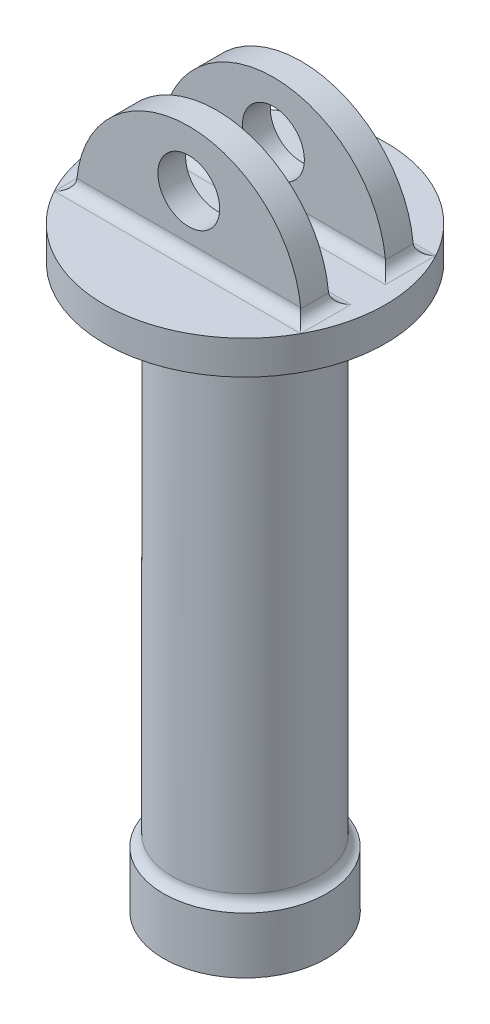
from build123d import *

# Parameters (mm, degrees)
SKETCH2_R            = 13
SKETCH2_R_2          = 10
BOSS_EXTRUDE3_DEPTH  = 100
SKETCH2_3_R          = 14.5
SKETCH2_3_R_2        = 13
BOSS_EXTRUDE5_DEPTH  = 10
SKETCH8_R            = 25
BOSS_EXTRUDE7_DEPTH  = 6
SKETCH11_R           = 5.5
BOSS_EXTRUDE12_DEPTH = 10
SKETCH14_W           = 47.941155358
SKETCH14_H           = 10.12177459
CUT_EXTRUDE2_DEPTH   = 112.740771431
FILLET1_START        = -12.0000001
FILLET1_2_DEPTH      = 2.0000001
FILLET1_START_2      = 3.060887195
FILLET1_3_DEPTH      = 2.0000001
FILLET1_START_3      = -5.060887295
FILLET1_4_DEPTH      = 2
FILLET1_START_4      = 10
FILLET1_5_DEPTH      = 2
FILLET1_START_5      = -10
FILLET1_6_DEPTH      = 4.939112705
FILLET1_START_6      = 5.060887295
FILLET1_7_DEPTH      = 4.939112705
FILLET1_START_7      = -21.9089024
FILLET1_8_DEPTH      = 43.8178047


with BuildPart() as part:
    # Sketch2 → Boss-Extrude3 (new body)
    with BuildSketch(Plane(origin=(0, 0, 0), x_dir=(1, 0, 0), z_dir=(0, 1, 0))):
        with Locations(Location((0, 0, 0), (0, 0, 270))):
            Circle(SKETCH2_R)
        with Locations(Location((0, 0, 0), (0, 0, 270))):
            Circle(SKETCH2_R_2, mode=Mode.SUBTRACT)
    extrude(amount=BOSS_EXTRUDE3_DEPTH)

    # Sketch2<3> → Boss-Extrude5 (add)
    with BuildSketch(Plane(origin=(0, 0, 0), x_dir=(1, 0, 0), z_dir=(0, 1, 0))):
        with Locations(Location((0, 0, 0), (0, 0, 270))):
            Circle(SKETCH2_3_R)
        with Locations(Location((0, 0, 0), (0, 0, 270))):
            Circle(SKETCH2_3_R_2, mode=Mode.SUBTRACT)
    extrude(amount=BOSS_EXTRUDE5_DEPTH)

    # Sketch8 → Boss-Extrude7 (add)
    with BuildSketch(Plane(origin=(0, 100, 0), x_dir=(1, 0, 0), z_dir=(0, 1, 0))):
        with Locations(Location((0, 0, 0), (0, 0, 270))):
            Circle(SKETCH8_R)
    extrude(amount=BOSS_EXTRUDE7_DEPTH)

    # Sketch11 → Boss-Extrude12 (add, symmetric)
    with BuildSketch(Plane.XY):
        with BuildLine():
            Line((20, 106), (-20, 106))
            ThreePointArc((-20, 106), (0, 126), (20, 106))
        make_face()
        with Locations((0, 116)):
            Circle(SKETCH11_R, mode=Mode.SUBTRACT)
    extrude(amount=BOSS_EXTRUDE12_DEPTH, both=True)

    # Sketch14 → Cut-Extrude2 (cut, through all)
    with BuildSketch(Plane(origin=(0, 106, 0), x_dir=(1, 0, 0), z_dir=(0, 1, 0))):
        Rectangle(SKETCH14_W, SKETCH14_H)
    extrude(amount=CUT_EXTRUDE2_DEPTH, mode=Mode.SUBTRACT)

    # Fillet1: read off the stored shape, not the designer's step
    # Fillet1 outline → Fillet1 (revolve)
    with BuildSketch(Plane.XY):
        with BuildLine():
            Line((15, 100), (13, 100))
            Line((13, 100), (13, 98))
            ThreePointArc((13, 98), (13.585786438, 99.414213562), (15, 100))
        make_face()
        with BuildLine():
            ThreePointArc((14.5, 10), (13.41886117, 10.711746802), (13, 11.936491673))
            Line((13, 11.936491673), (13, 10))
            Line((13, 10), (14.5, 10))
        make_face()
    revolve(axis=Axis((0, 0, 0), (0, 1, 0)))

    # Fillet1 2 outline → Fillet1 2 (add)
    with BuildSketch(Plane.XY.offset(FILLET1_START)):
        with BuildLine():
            ThreePointArc((21.9089023, 106), (20.560502575, 106.522902108), (19.917183909, 107.818181818))
            ThreePointArc((19.917183909, 107.818181818), (0, 126), (-19.917183909, 107.818181818))
            ThreePointArc((-19.917183909, 107.818181818), (-20.560502575, 106.522902108), (-21.9089023, 106))
            Line((-21.9089023, 106), (21.9089023, 106))
        make_face()
    extrude(amount=FILLET1_2_DEPTH)

    # Fillet1 3 outline → Fillet1 3 (add)
    with BuildSketch(Plane.XY.offset(FILLET1_START_2)):
        with BuildLine():
            ThreePointArc((21.9089023, 106), (20.560502575, 106.522902108), (19.917183909, 107.818181818))
            ThreePointArc((19.917183909, 107.818181818), (0, 126), (-19.917183909, 107.818181818))
            ThreePointArc((-19.917183909, 107.818181818), (-20.560502575, 106.522902108), (-21.9089023, 106))
            Line((-21.9089023, 106), (21.9089023, 106))
        make_face()
    extrude(amount=FILLET1_3_DEPTH)

    # Fillet1 4 outline → Fillet1 4 (add)
    with BuildSketch(Plane.XY.offset(FILLET1_START_3)):
        with BuildLine():
            ThreePointArc((21.9089023, 106), (20.560502575, 106.522902108), (19.917183909, 107.818181818))
            ThreePointArc((19.917183909, 107.818181818), (0, 126), (-19.917183909, 107.818181818))
            ThreePointArc((-19.917183909, 107.818181818), (-20.560502575, 106.522902108), (-21.9089023, 106))
            Line((-21.9089023, 106), (21.9089023, 106))
        make_face()
    extrude(amount=FILLET1_4_DEPTH)

    # Fillet1 5 outline → Fillet1 5 (add)
    with BuildSketch(Plane.XY.offset(FILLET1_START_4)):
        with BuildLine():
            ThreePointArc((21.9089023, 106), (20.560502575, 106.522902108), (19.917183909, 107.818181818))
            ThreePointArc((19.917183909, 107.818181818), (0, 126), (-19.917183909, 107.818181818))
            ThreePointArc((-19.917183909, 107.818181818), (-20.560502575, 106.522902108), (-21.9089023, 106))
            Line((-21.9089023, 106), (21.9089023, 106))
        make_face()
    extrude(amount=FILLET1_5_DEPTH)

    # Fillet1 6 outline → Fillet1 6 (add)
    with BuildSketch(Plane.XY.offset(FILLET1_START_5)):
        with BuildLine():
            Line((20, 106), (21.9089023, 106))
            ThreePointArc((21.9089023, 106), (20.560502575, 106.522902108), (19.917183909, 107.818181818))
            ThreePointArc((19.917183909, 107.818181818), (19.97928525, 106.910033465), (20, 106))
        make_face()
        with BuildLine():
            ThreePointArc((-20, 106), (-19.97928525, 106.910033465), (-19.917183909, 107.818181818))
            ThreePointArc((-19.917183909, 107.818181818), (-20.560502575, 106.522902108), (-21.9089023, 106))
            Line((-21.9089023, 106), (-20, 106))
        make_face()
    extrude(amount=FILLET1_6_DEPTH)

    # Fillet1 7 outline → Fillet1 7 (add)
    with BuildSketch(Plane.XY.offset(FILLET1_START_6)):
        with BuildLine():
            Line((20, 106), (21.9089023, 106))
            ThreePointArc((21.9089023, 106), (20.560502575, 106.522902108), (19.917183909, 107.818181818))
            ThreePointArc((19.917183909, 107.818181818), (19.97928525, 106.910033465), (20, 106))
        make_face()
        with BuildLine():
            ThreePointArc((-20, 106), (-19.97928525, 106.910033465), (-19.917183909, 107.818181818))
            ThreePointArc((-19.917183909, 107.818181818), (-20.560502575, 106.522902108), (-21.9089023, 106))
            Line((-21.9089023, 106), (-20, 106))
        make_face()
    extrude(amount=FILLET1_7_DEPTH)

    # Fillet1 8 outline → Fillet1 8 (cut)
    with BuildSketch(Plane.YZ.offset(FILLET1_START_7)):
        with BuildLine():
            Line((108, 10), (127, 10))
            Line((127, 10), (127, 12))
            Line((127, 12), (106, 12))
            ThreePointArc((106, 12), (106.585786438, 10.585786438), (108, 10))
        make_face()
        with BuildLine():
            Line((127, 3.060887195), (127, 5.060887295))
            Line((127, 5.060887295), (108, 5.060887295))
            ThreePointArc((108, 5.060887295), (106.585786438, 4.475100858), (106, 3.060887295))
            Line((106, 3.060887295), (127, 3.060887195))
        make_face()
        with BuildLine():
            Line((127, -5.060887295), (127, -3.060887295))
            Line((127, -3.060887295), (106, -3.060887295))
            ThreePointArc((106, -3.060887295), (106.585786438, -4.475100858), (108, -5.060887295))
            Line((108, -5.060887295), (127, -5.060887295))
        make_face()
        with BuildLine():
            Line((127, -12.0000001), (127, -10))
            Line((127, -10), (108, -10))
            ThreePointArc((108, -10), (106.585786438, -10.585786438), (106, -12))
            Line((106, -12), (127, -12.0000001))
        make_face()
    extrude(amount=FILLET1_8_DEPTH, mode=Mode.SUBTRACT)


solid = part.part
